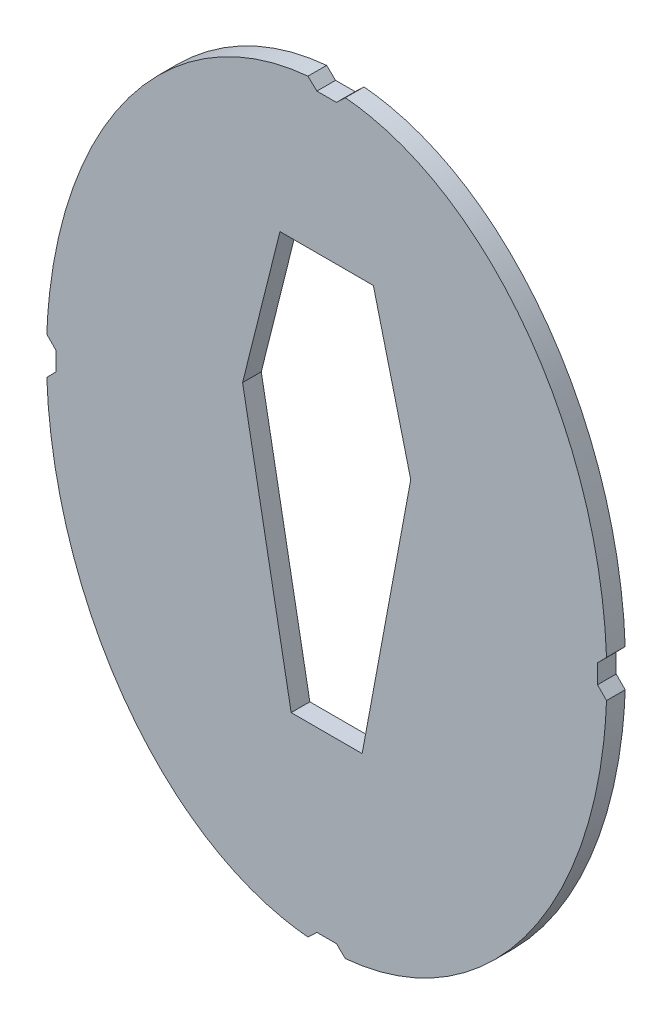
from build123d import *

# Parameters (mm, degrees)
SKETCH_1_RX         = 20
SKETCH_1_RY         = 15
EXTRUDE_1_DEPTH     = 1
CUT_EXTRUDE_1_DEPTH = 1
SKETCH_3_W          = 1
SKETCH_3_H          = 1
CUT_EXTRUDE_2_DEPTH = 1
CHAMFER_START       = -1
CHAMFER_1_DEPTH     = 3


with BuildPart() as part:
    # 스케치1 → 보스-돌출1 (new body)
    with BuildSketch(Plane.XY):
        with Locations(Location((0, 0), (0, 0, -90))):
            Ellipse(SKETCH_1_RX, SKETCH_1_RY)
    extrude(amount=EXTRUDE_1_DEPTH)

    # 스케치2 → 컷-돌출1 (cut)
    with BuildSketch(Plane.XY.offset(1)):
        Polygon((2.5, 12), (-2.5, 12), (-4.5, 4), (-1.9, -10), (1.9, -10), (4.5, 4), align=None)
    extrude(amount=-CUT_EXTRUDE_1_DEPTH, mode=Mode.SUBTRACT)

    # 스케치3 → 컷-돌출2 (cut)
    with BuildSketch(Plane.XY.offset(1)):
        with Locations((0, 20)):
            Rectangle(SKETCH_3_W, SKETCH_3_H)
        with Locations((15, 0)):
            Rectangle(SKETCH_3_W, SKETCH_3_H)
        with Locations((-15, 0)):
            Rectangle(SKETCH_3_W, SKETCH_3_H)
        with Locations((0, -20)):
            Rectangle(SKETCH_3_W, SKETCH_3_H)
    extrude(amount=-CUT_EXTRUDE_2_DEPTH, mode=Mode.SUBTRACT)

    # 모따기1: read off the stored shape, not the designer's step
    # 모따기1 outline → 모따기1 (cut)
    with BuildSketch(Plane.XY.offset(CHAMFER_START)):
        with BuildLine():
            Line((-14.5, 0.509476942), (-14.981237977, 1.0000077))
            add(Edge.make_bspline(
                [(-14.981237977, 1.0000077), (-14.990620528, 0.750121225), (-14.995311767, 0.5)],
                knots=[4.659948749, 4.659948749, 4.659948749, 4.687386375, 4.687386375, 4.687386375], degree=2, weights=[0.990289953, 0.995055274, 1]))
            Line((-14.995311767, 0.5), (-14.5, 0.5))
            Line((-14.5, 0.5), (-14.5, 0.509476942))
        make_face()
        with BuildLine():
            add(Edge.make_bspline(
                [(-0.5, 19.988885801), (-0.750180122, 19.977760502), (-0.999942528, 19.955511183)],
                knots=[3.174932163, 3.174932163, 3.174932163, 3.211472839, 3.211472839, 3.211472839], degree=2, weights=[1, 0.99341475, 0.987147697]))
            Line((-0.999942528, 19.955511183), (-0.522817559, 19.5))
            Line((-0.522817559, 19.5), (-0.5, 19.5))
            Line((-0.5, 19.5), (-0.5, 19.988885801))
        make_face()
        with BuildLine():
            Line((-14.5, -0.509476942), (-14.5, -0.5))
            Line((-14.5, -0.5), (-14.995311767, -0.5))
            add(Edge.make_bspline(
                [(-14.995311767, -0.5), (-14.990620528, -0.750121225), (-14.981237977, -1.0000077)],
                knots=[4.737391585, 4.737391585, 4.737391585, 4.764829212, 4.764829212, 4.764829212], degree=2, weights=[1, 0.995055274, 0.990289953]))
            Line((-14.981237977, -1.0000077), (-14.5, -0.509476942))
        make_face()
        with BuildLine():
            Line((0.5, 19.988885801), (0.5, 19.5))
            Line((0.5, 19.5), (0.522817559, 19.5))
            Line((0.522817559, 19.5), (0.999942528, 19.955511183))
            add(Edge.make_bspline(
                [(0.999942528, 19.955511183), (0.750180122, 19.977760502), (0.5, 19.988885801)],
                knots=[3.071712468, 3.071712468, 3.071712468, 3.108253144, 3.108253144, 3.108253144], degree=2, weights=[0.987147697, 0.99341475, 1]))
        make_face()
        with BuildLine():
            Line((-0.522817559, -19.5), (-0.999942528, -19.955511183))
            add(Edge.make_bspline(
                [(-0.999942528, -19.955511183), (-0.750180122, -19.977760502), (-0.5, -19.988885801)],
                knots=[6.213305122, 6.213305122, 6.213305122, 6.249845798, 6.249845798, 6.249845798], degree=2, weights=[0.987147697, 0.99341475, 1]))
            Line((-0.5, -19.988885801), (-0.5, -19.5))
            Line((-0.5, -19.5), (-0.522817559, -19.5))
        make_face()
        with BuildLine():
            add(Edge.make_bspline(
                [(14.995311767, 0.5), (14.990620528, 0.750121225), (14.981237977, 1.0000077)],
                knots=[1.595798932, 1.595798932, 1.595798932, 1.623236559, 1.623236559, 1.623236559], degree=2, weights=[1, 0.995055274, 0.990289953]))
            Line((14.981237977, 1.0000077), (14.5, 0.509476942))
            Line((14.5, 0.509476942), (14.5, 0.5))
            Line((14.5, 0.5), (14.995311767, 0.5))
        make_face()
        with BuildLine():
            Line((0.522817559, -19.5), (0.5, -19.5))
            Line((0.5, -19.5), (0.5, -19.988885801))
            add(Edge.make_bspline(
                [(0.5, -19.988885801), (0.750180122, -19.977760502), (0.999942528, -19.955511183)],
                knots=[0.033339509, 0.033339509, 0.033339509, 0.069880186, 0.069880186, 0.069880186], degree=2, weights=[1, 0.99341475, 0.987147697]))
            Line((0.999942528, -19.955511183), (0.522817559, -19.5))
        make_face()
        with BuildLine():
            Line((14.995311767, -0.5), (14.5, -0.5))
            Line((14.5, -0.5), (14.5, -0.509476942))
            Line((14.5, -0.509476942), (14.981237977, -1.0000077))
            add(Edge.make_bspline(
                [(14.981237977, -1.0000077), (14.990620528, -0.750121225), (14.995311767, -0.5)],
                knots=[1.518356095, 1.518356095, 1.518356095, 1.545793722, 1.545793722, 1.545793722], degree=2, weights=[0.990289953, 0.995055274, 1]))
        make_face()
    extrude(amount=CHAMFER_1_DEPTH, mode=Mode.SUBTRACT)


solid = part.part
